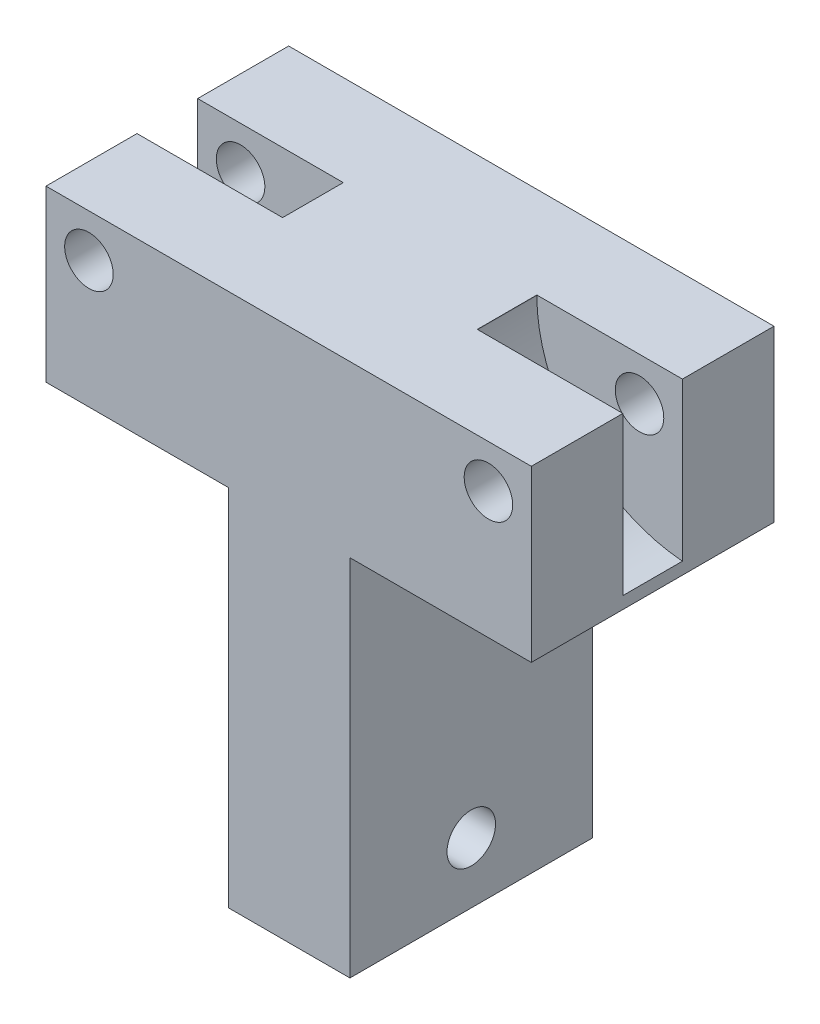
from build123d import *

# Parameters (mm, degrees)
CROQUIS2_W              = 5
CROQUIS2_H              = 10
SALIENTE_EXTRUIR1_DEPTH = 15
CROQUIS3_R              = 1
CORTAR_EXTRUIR1_DEPTH   = 19.708286934
CROQUIS4_W              = 20
CROQUIS4_H              = 10
SALIENTE_EXTRUIR2_DEPTH = 7
CROQUIS5_W              = 2.5
CROQUIS5_H              = 6.5
CORTAR_EXTRUIR2_DEPTH   = 6
CROQUIS6_R              = 1
CORTAR_EXTRUIR3_DEPTH   = 27.162895312
CROQUIS7_W              = 2.453318502
CROQUIS7_H              = 6.5
CORTAR_EXTRUIR4_DEPTH   = 6
CROQUIS8_R              = 1
CORTAR_EXTRUIR5_DEPTH   = 27.162895312
REDONDEO1_R             = 6.5


with BuildPart() as part:
    # Croquis2 → Saliente-Extruir1 (new body)
    with BuildSketch(Plane(origin=(0, 0, 0), x_dir=(1, 0, 0), z_dir=(0, 1, 0))):
        with Locations((0, 5)):
            Rectangle(CROQUIS2_W, CROQUIS2_H)
    extrude(amount=SALIENTE_EXTRUIR1_DEPTH)

    # Croquis3 → Cortar-Extruir1 (cut, through all)
    with BuildSketch(Plane(origin=(2.5, 0, 0), x_dir=(0, 0, -1), z_dir=(1, 0, 0))):
        with Locations((5, 2.5)):
            Circle(CROQUIS3_R)
    extrude(amount=-CORTAR_EXTRUIR1_DEPTH, mode=Mode.SUBTRACT)

    # Croquis4 → Saliente-Extruir2 (add)
    with BuildSketch(Plane(origin=(0, 15, 0), x_dir=(1, 0, 0), z_dir=(0, 1, 0))):
        with Locations((-0.024823745, 5)):
            Rectangle(CROQUIS4_W, CROQUIS4_H)
    extrude(amount=SALIENTE_EXTRUIR2_DEPTH)

    # Croquis5 → Cortar-Extruir2 (cut)
    with BuildSketch(Plane.ZY.offset(10.024823745)):
        with Locations((-5, 18.75)):
            Rectangle(CROQUIS5_W, CROQUIS5_H)
    extrude(amount=-CORTAR_EXTRUIR2_DEPTH, mode=Mode.SUBTRACT)

    # Croquis6 → Cortar-Extruir3 (cut, through all)
    with BuildSketch(Plane(origin=(0, 0, -10), x_dir=(-1, 0, 0), z_dir=(0, 0, -1))):
        with Locations((8.257056792, 20.232233047)):
            Circle(CROQUIS6_R)
    extrude(amount=-CORTAR_EXTRUIR3_DEPTH, mode=Mode.SUBTRACT)

    # Croquis7 → Cortar-Extruir4 (cut)
    with BuildSketch(Plane(origin=(9.975176255, 0, 0), x_dir=(0, 0, -1), z_dir=(1, 0, 0))):
        with Locations((5, 18.75)):
            Rectangle(CROQUIS7_W, CROQUIS7_H)
    extrude(amount=-CORTAR_EXTRUIR4_DEPTH, mode=Mode.SUBTRACT)

    # Croquis8 → Cortar-Extruir5 (cut, through all)
    with BuildSketch(Plane(origin=(0, 0, -10), x_dir=(-1, 0, 0), z_dir=(0, 0, -1))):
        with Locations((-8.207409302, 20.232233047)):
            Circle(CROQUIS8_R)
    extrude(amount=-CORTAR_EXTRUIR5_DEPTH, mode=Mode.SUBTRACT)

    # Redondeo1
    # the kernel refuses this fillet: 6.5 mm, written as the material it adds along each edge
    with BuildSketch(Plane(origin=(-4.024823745, 15.5, -3.75), x_dir=(-1, 0, 0), z_dir=(0, 0, -1))) as redondeo1_piece_1:
        with BuildLine():
            CenterArc((6.5, 6.480740698), REDONDEO1_R, 180, 85.588274214)
            Line((0, 6.480740698), (-0.13, 6.480740698))
            Line((-0.13, 6.480740698), (-0.13, 0))
            Line((-0.13, 0), (0, -0.13))
            ThreePointArc((0, -0.13), (3, -0.13), (5.99, -0.129614814))
            Line((5.99, -0.129614814), (6, 0))
        make_face()
    extrude(amount=2.5)
    with BuildSketch(Plane(origin=(3.975176255, 15.5, -6.226659251), x_dir=(0, 1, 0), z_dir=(0, 0, 1))) as redondeo1_piece_2:
        with BuildLine():
            CenterArc((6.480740698, -6.5), REDONDEO1_R, 90, 85.588274214)
            Line((0, -6), (-0.129614814, -5.99))
            ThreePointArc((-0.129614814, -5.99), (-0.13, -3), (-0.13, 0))
            Line((-0.13, 0), (0, 0.13))
            Line((0, 0.13), (6.480740698, 0.13))
            Line((6.480740698, 0.13), (6.480740698, 0))
        make_face()
    extrude(amount=2.453318501)


solid = part.part
